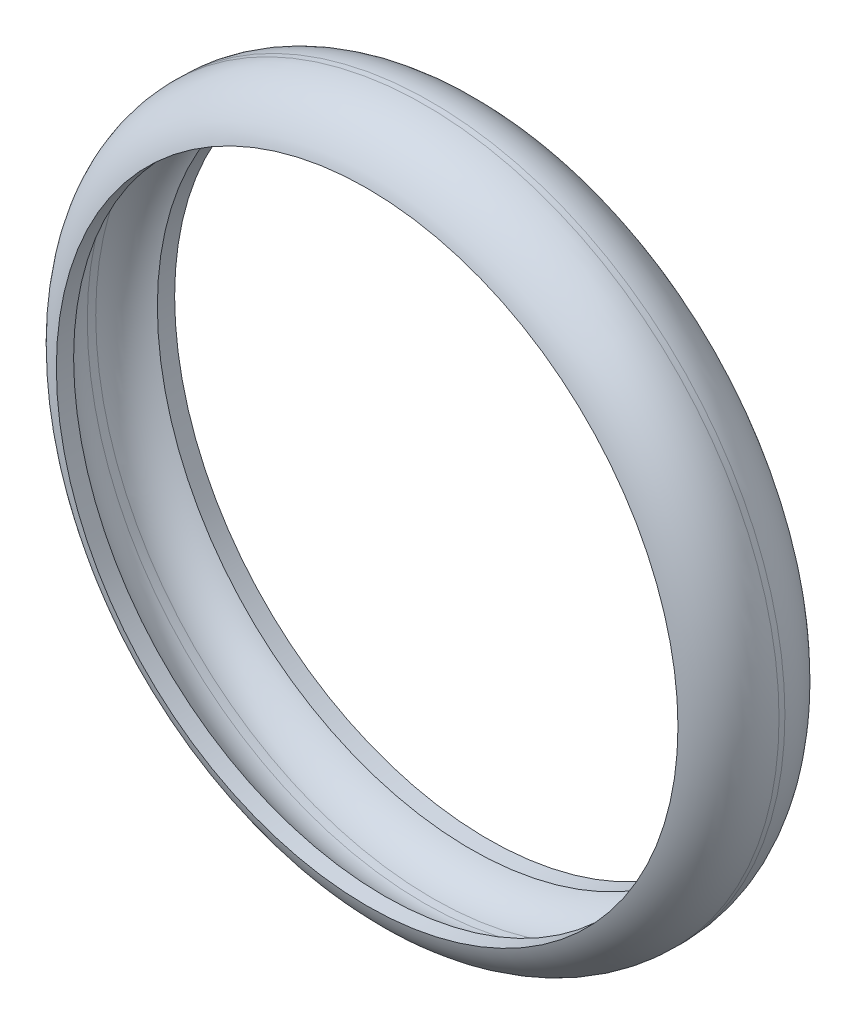
from build123d import *

# Parameters (mm, degrees)
SKETCH1_R           = 41
SKETCH1_R_2         = 39
BOSS_EXTRUDE1_DEPTH = 10
SKETCH2_R           = 41
SKETCH2_R_2         = 36
BOSS_EXTRUDE2_DEPTH = 2
BOSS_EXTRUDE3_START = 2
SKETCH3_R           = 41
SKETCH3_R_2         = 36.3
BOSS_EXTRUDE3_DEPTH = 2
FILLET2_R           = 5
FILLET6_R           = 7


with BuildPart() as part:
    # Sketch1 → Boss-Extrude1 (new body)
    with BuildSketch(Plane.XY):
        Circle(SKETCH1_R)
        Circle(SKETCH1_R_2, mode=Mode.SUBTRACT)
    extrude(amount=BOSS_EXTRUDE1_DEPTH)

    # Sketch2 → Boss-Extrude2 (add)
    with BuildSketch(Plane.XY.offset(10)):
        Circle(SKETCH2_R)
        Circle(SKETCH2_R_2, mode=Mode.SUBTRACT)
    extrude(amount=BOSS_EXTRUDE2_DEPTH)

    # Sketch3 → Boss-Extrude3 (add)
    with BuildSketch(Plane(origin=(0, 0, 0), x_dir=(-1, 0, 0), z_dir=(0, 0, -1)).offset(BOSS_EXTRUDE3_START)):
        Circle(SKETCH3_R)
        Circle(SKETCH3_R_2, mode=Mode.SUBTRACT)
    extrude(amount=-BOSS_EXTRUDE3_DEPTH)

    # Fillet2
    # the kernel refuses this fillet: 5 mm, written as the material it adds along each edge
    with BuildSketch(Plane(origin=(0, 0, 10), x_dir=(1, 0, 0), z_dir=(0, -1, 0))) as fillet2_piece_1:
        with BuildLine():
            CenterArc((34, -4.582575695), FILLET2_R, 0, 66.421821522)
            Line((39, -4.582575695), (39.1, -4.582575695))
            Line((39.1, -4.582575695), (39.1, 0))
            Line((39.1, 0), (39, 0.1))
            ThreePointArc((39, 0.1), (37.5, 0.1), (36.04, 0.091651514))
            Line((36.04, 0.091651514), (36, 0))
        make_face()
    revolve(axis=Axis((0, 0, 10), (0, 0, 1)))
    with BuildSketch(Plane(origin=(0, 0, 0), x_dir=(1, 0, 0), z_dir=(0, -1, 0))) as fillet2_piece_2:
        with BuildLine():
            CenterArc((34, 4.439594576), FILLET2_R, 297.387107503, 62.612892497)
            Line((36.3, 0), (36.346, -0.088791892))
            ThreePointArc((36.346, -0.088791892), (37.65, -0.1), (39, -0.1))
            Line((39, -0.1), (39.1, 0))
            Line((39.1, 0), (39.1, 4.439594576))
            Line((39.1, 4.439594576), (39, 4.439594576))
        make_face()
    revolve(axis=Axis((0, 0, 0), (0, 0, 1)))

    # Fillet6
    # the kernel refuses this fillet: 7 mm, written as the material it takes off along each edge
    with BuildSketch(Plane(origin=(0, 0, -2), x_dir=(-1, 0, 0), z_dir=(0, -1, 0))) as fillet6_piece_1:
        with BuildLine():
            CenterArc((34, -6.61135387), FILLET6_R, 0, 70.817910057)
            Line((41, -6.61135387), (41.14, -6.61135387))
            Line((41.14, -6.61135387), (41.14, 0))
            Line((41.14, 0), (41, 0.14))
            ThreePointArc((41, 0.14), (38.65, 0.14), (36.346, 0.132227077))
            Line((36.346, 0.132227077), (36.3, 0))
        make_face()
    revolve(axis=Axis((0, 0, -2), (0, 0, -1)), mode=Mode.SUBTRACT)
    with BuildSketch(Plane(origin=(0, 0, 12), x_dir=(1, 0, 0), z_dir=(0, -1, 0))) as fillet6_piece_2:
        with BuildLine():
            CenterArc((34, -6.708203932), FILLET6_R, 0, 73.398450401)
            Line((36, 0), (36.04, 0.134164079))
            ThreePointArc((36.04, 0.134164079), (38.5, 0.14), (41, 0.14))
            Line((41, 0.14), (41.14, 0))
            Line((41.14, 0), (41.14, -6.708203932))
            Line((41.14, -6.708203932), (41, -6.708203932))
        make_face()
    revolve(axis=Axis((0, 0, 12), (0, 0, 1)), mode=Mode.SUBTRACT)


solid = part.part
